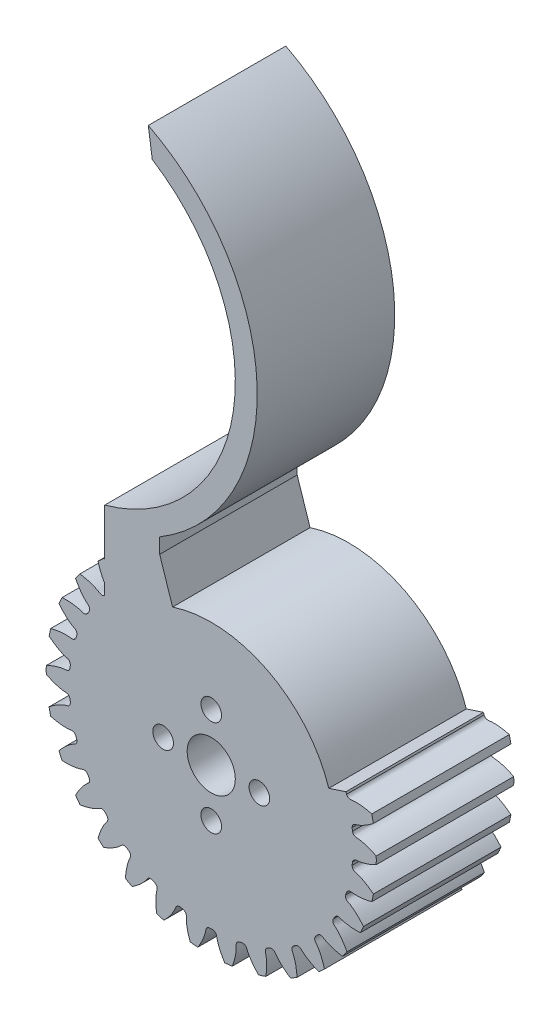
from build123d import *

# Parameters (mm, degrees)
SKETCH_1_R               = 24
EXTRUDE_1_DEPTH          = 20
CUT_EXTRUDE_1_DEPTH      = 40.395431207
PATTERN_CIRCULAR_1_COUNT = 30
SKETCH_4_R               = 15
CUT_EXTRUDE_2_DEPTH      = 12
SKETCH_6_R               = 3.5
SKETCH_6_R_2             = 1.5
CUT_EXTRUDE_3_DEPTH      = 10
EXTRUDE_2_DEPTH          = 20
CUT_EXTRUDE_START        = -20
CUT_EXTRUDE_4_DEPTH      = 20


with BuildPart() as part:
    # 草图1 → 凸台-拉伸1 (new body)
    with BuildSketch(Plane.XY):
        Circle(SKETCH_1_R)
    extrude(amount=EXTRUDE_1_DEPTH)

    # 草图2 → 切除-拉伸1 (cut, through all)
    with BuildSketch(Plane.XY):
        with BuildLine():
            ThreePointArc((0.218337943, 20.623844296), (0, 20.625), (-0.218337943, 20.623844296))
            add(Edge.make_bspline(
                [(-0.218337943, 20.623844296), (-0.762346034, 20.719462755), (-0.76545712, 21.070698954), (-0.83847723, 21.432868523), (-0.854926112, 21.507193856), (-0.874870629, 21.589387364), (-0.898601576, 21.679346988), (-0.926445936, 21.776947361), (-0.958715037, 21.882057771), (-0.995720269, 21.994536716), (-1.037767941, 22.114233691), (-1.085160513, 22.240988783), (-1.138195901, 22.374632925), (-1.197167364, 22.514987974), (-1.262363223, 22.66186684), (-1.334066627, 22.815073613), (-1.412555321, 22.974403691), (-1.498101405, 23.139643929), (-1.590971111, 23.310572775), (-1.691424568, 23.486960424), (-1.79971559, 23.668568976), (-1.916091444, 23.855152596), (-2.040792645, 24.046457683), (-2.174052743, 24.242223041), (-2.31609811, 24.442180061), (-2.467147746, 24.6460529), (-2.627413076, 24.853558674), (-2.797097758, 25.064407647), (-2.976397494, 25.278303435), (-3.165499848, 25.494943205), (-3.364584064, 25.714017885), (-3.573820897, 25.935212377), (-3.793372437, 26.158205771), (-4.023391966, 26.38267157), (-4.264023724, 26.608277918), (-4.603385799, 26.913931243), (-4.868016928, 27.138107297), (-5.049467747, 27.285837184)],
                knots=[0, 0, 0, 0, 0.115323882, 0.12341257, 0.132512303, 0.142623081, 0.153744905, 0.165877774, 0.179021689, 0.193176649, 0.208342655, 0.224519706, 0.241707802, 0.259906945, 0.279117132, 0.299338365, 0.320570644, 0.342813968, 0.366068337, 0.390333752, 0.415610213, 0.441897719, 0.46919627, 0.497505867, 0.52682651, 0.557158198, 0.588500931, 0.62085471, 0.654219534, 0.688595404, 0.723982319, 0.76038028, 0.797789286, 0.836209338, 0.875640435, 0.916082578, 1, 1, 1, 1], degree=3))
            ThreePointArc((-5.049467747, 27.285837184), (0, 27.74912675), (5.049467747, 27.285837184))
            add(Edge.make_bspline(
                [(0.218337943, 20.623844296), (0.762346034, 20.719462755), (0.76545712, 21.070698954), (0.83847723, 21.432868523), (0.854926112, 21.507193856), (0.874870629, 21.589387364), (0.898601576, 21.679346988), (0.926445936, 21.776947361), (0.958715037, 21.882057771), (0.995720269, 21.994536716), (1.037767941, 22.114233691), (1.085160513, 22.240988783), (1.138195901, 22.374632925), (1.197167364, 22.514987974), (1.262363223, 22.66186684), (1.334066627, 22.815073613), (1.412555321, 22.974403691), (1.498101405, 23.139643929), (1.590971111, 23.310572775), (1.691424568, 23.486960424), (1.79971559, 23.668568976), (1.916091444, 23.855152596), (2.040792645, 24.046457683), (2.174052743, 24.242223041), (2.31609811, 24.442180061), (2.467147746, 24.6460529), (2.627413076, 24.853558674), (2.797097758, 25.064407647), (2.976397494, 25.278303435), (3.165499848, 25.494943205), (3.364584064, 25.714017885), (3.573820897, 25.935212377), (3.793372437, 26.158205771), (4.023391966, 26.38267157), (4.264023724, 26.608277918), (4.603385799, 26.913931243), (4.868016928, 27.138107297), (5.049467747, 27.285837184)],
                knots=[0, 0, 0, 0, 0.115323882, 0.12341257, 0.132512303, 0.142623081, 0.153744905, 0.165877774, 0.179021689, 0.193176649, 0.208342655, 0.224519706, 0.241707802, 0.259906945, 0.279117132, 0.299338365, 0.320570644, 0.342813968, 0.366068337, 0.390333752, 0.415610213, 0.441897719, 0.46919627, 0.497505867, 0.52682651, 0.557158198, 0.588500931, 0.62085471, 0.654219534, 0.688595404, 0.723982319, 0.76038028, 0.797789286, 0.836209338, 0.875640435, 0.916082578, 1, 1, 1, 1], degree=3))
        make_face()
    cut_extrude_1 = extrude(amount=CUT_EXTRUDE_1_DEPTH, mode=Mode.SUBTRACT)

    # 阵列(圆周)1: 切除-拉伸1 ×30 about axis
    pattern_circular_1_axis = Axis((0, 0, -1.5), (0, 0, 1))
    for i in range(1, PATTERN_CIRCULAR_1_COUNT):
        add(cut_extrude_1.rotate(pattern_circular_1_axis, i * 360 / PATTERN_CIRCULAR_1_COUNT), mode=Mode.SUBTRACT)

    # 草图4 → 切除-拉伸2 (cut)
    with BuildSketch(Plane(origin=(0, 0, 0), x_dir=(-1, 0, 0), z_dir=(0, 0, -1))):
        Circle(SKETCH_4_R)
    extrude(amount=-CUT_EXTRUDE_2_DEPTH, mode=Mode.SUBTRACT)

    # 草图6 → 切除-拉伸3 (cut)
    with BuildSketch(Plane.XY.offset(20)):
        Circle(SKETCH_6_R)
        with Locations((0, 7)):
            Circle(SKETCH_6_R_2)
        with Locations((7, 0)):
            Circle(SKETCH_6_R_2)
        with Locations((0, -7)):
            Circle(SKETCH_6_R_2)
        with Locations((-7, 0)):
            Circle(SKETCH_6_R_2)
    extrude(amount=-CUT_EXTRUDE_3_DEPTH, mode=Mode.SUBTRACT)

    # 草图7 → 凸台-拉伸2 (add)
    with BuildSketch(Plane.XY.offset(20)):
        with BuildLine():
            ThreePointArc((-15.5, 8.124038405), (-12.125338639, 12.618484968), (-7.5, 15.811388301))
            Line((-7.5, 15.811388301), (-7.5, 25))
            ThreePointArc((-7.5, 25), (6.673673636, 50.986945639), (-9.155460247, 76))
            Line((-9.155460247, 76), (-8.580337763, 72))
            ThreePointArc((-8.580337763, 72), (3.222715001, 46.252893591), (-15.5, 25))
            Line((-15.5, 25), (-15.5, 8.124038405))
        make_face()
    extrude(amount=-EXTRUDE_2_DEPTH)

    # 草图9 → 切除-拉伸4 (cut)
    with BuildSketch(Plane.XY.offset(20).offset(CUT_EXTRUDE_START)):
        with BuildLine():
            Line((-7.5, 22.79802623), (-5.625, 17.098519673))
            ThreePointArc((-5.625, 17.098519673), (8.113003565, 16.067954853), (17.098519673, 5.625))
            Line((17.098519673, 5.625), (22.79802623, 7.5))
            ThreePointArc((22.79802623, 7.5), (10.817338086, 21.423939804), (-7.5, 22.79802623))
        make_face()
    extrude(amount=CUT_EXTRUDE_4_DEPTH, mode=Mode.SUBTRACT)


solid = part.part
